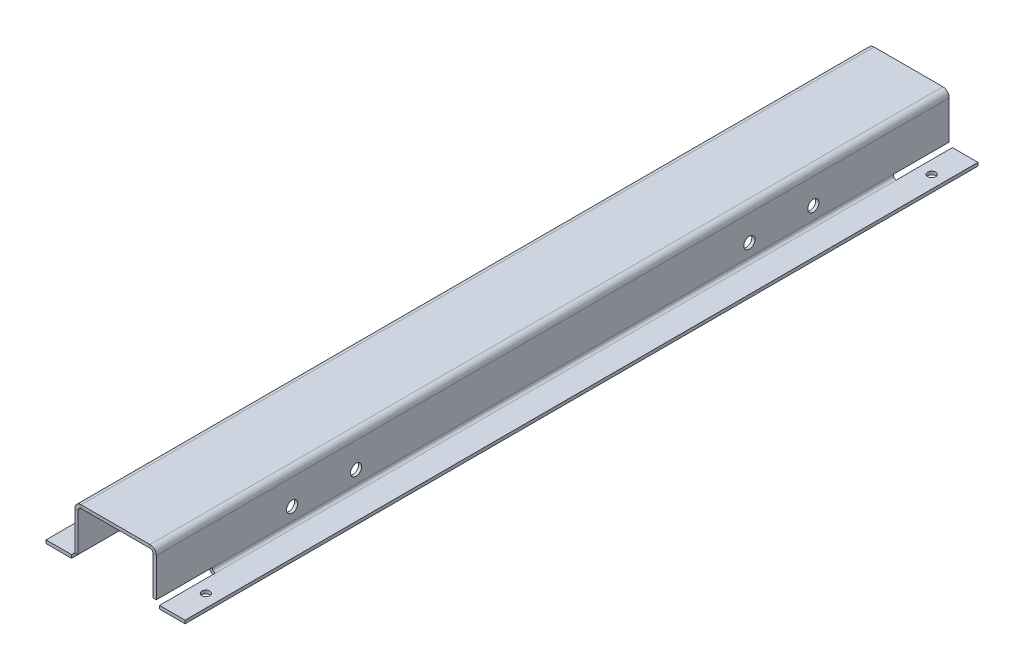
from build123d import *

# Parameters (mm, degrees)
SM_BASE_FLANGE_1_DEPTH   = 248
SKETCH_7_W               = 35
SKETCH_7_H               = 4
CUT_EXTRUDE_1_DEPTH      = 4
SKETCH_8_W               = 35
SKETCH_8_H               = 4
CUT_EXTRUDE_2_DEPTH      = 4
SKETCH_9_R               = 2.5
CUT_EXTRUDE_3_DEPTH      = 4
SKETCH_11_W              = 8.403654654
SKETCH_11_H              = 30.785672442
SKETCH_11_H_2            = 25.612573904
SM_BASE_FLANGE_1_2_DEPTH = 2
CUT_EXTRUDE_5_DEPTH      = 259.636810992
CUT_EXTRUDE_5_DEPTH_BACK = 259.636810992
SKETCH_14_R              = 3.5


# Sheet-metal steps are written as plain solids
with BuildPart() as part:
    # Sketch 1 → Sm Base Flange 1 (new, symmetric)
    with BuildSketch(Plane.XY):
        with BuildLine():
            Line((-43.5, -30), (-27.5, -30))
            ThreePointArc((-27.5, -30), (-24.671572875, -28.828427125), (-23.5, -26))
            Line((-23.5, -26), (-23.5, -2))
            ThreePointArc((-23.5, -2), (-22.914213562, -0.585786438), (-21.5, 0))
            Line((-21.5, 0), (21.5, 0))
            ThreePointArc((21.5, 0), (22.914213562, -0.585786438), (23.5, -2))
            Line((23.5, -2), (23.5, -26))
            ThreePointArc((23.5, -26), (24.671572875, -28.828427125), (27.5, -30))
            Line((27.5, -30), (43.5, -30))
            Line((43.5, -30), (43.5, -28))
            Line((43.5, -28), (27.5, -28))
            ThreePointArc((27.5, -28), (26.085786438, -27.414213562), (25.5, -26))
            Line((25.5, -26), (25.5, -2))
            ThreePointArc((25.5, -2), (24.328427125, 0.828427125), (21.5, 2))
            Line((21.5, 2), (-21.5, 2))
            ThreePointArc((-21.5, 2), (-24.328427125, 0.828427125), (-25.5, -2))
            Line((-25.5, -2), (-25.5, -26))
            ThreePointArc((-25.5, -26), (-26.085786438, -27.414213562), (-27.5, -28))
            Line((-27.5, -28), (-43.5, -28))
            Line((-43.5, -28), (-43.5, -30))
        make_face()
    extrude(amount=SM_BASE_FLANGE_1_DEPTH, both=True)

    # Эскиз7 → Вырез-Вытянуть1 (cut)
    with BuildSketch(Plane.ZY.offset(-23.5)):
        with Locations((230.5, -28)):
            Rectangle(SKETCH_7_W, SKETCH_7_H)
        with Locations((-230.5, -28)):
            Rectangle(SKETCH_7_W, SKETCH_7_H)
    extrude(amount=-CUT_EXTRUDE_1_DEPTH, mode=Mode.SUBTRACT)

    # Эскиз8 → Вырез-Вытянуть2 (cut)
    with BuildSketch(Plane(origin=(-23.5, 0, 0), x_dir=(0, 0, -1), z_dir=(1, 0, 0))):
        with Locations((230.5, -28)):
            Rectangle(SKETCH_8_W, SKETCH_8_H)
        with Locations((-230.5, -28)):
            Rectangle(SKETCH_8_W, SKETCH_8_H)
    extrude(amount=-CUT_EXTRUDE_2_DEPTH, mode=Mode.SUBTRACT)

    # Эскиз9 → Вырез-Вытянуть3 (cut)
    with BuildSketch(Plane(origin=(0, -28, 0), x_dir=(1, 0, 0), z_dir=(0, 1, 0))):
        with Locations(Location((-35.5, 227, 0), (0, 0, 180))):
            Circle(SKETCH_9_R)
        with Locations(Location((-34.5, 195, 0), (0, 0, 180))):
            Circle(SKETCH_9_R)
        with Locations(Location((-34.5, 179, 0), (0, 0, 180))):
            Circle(SKETCH_9_R)
        with Locations((-34.5, -179)):
            Circle(SKETCH_9_R)
        with Locations((-34.5, -195)):
            Circle(SKETCH_9_R)
        with Locations((-35.5, -227)):
            Circle(SKETCH_9_R)
        with Locations((35.5, 227)):
            Circle(SKETCH_9_R)
        with Locations(Location((35.5, -227, 0), (0, 0, 180))):
            Circle(SKETCH_9_R)
    extrude(amount=-CUT_EXTRUDE_3_DEPTH, mode=Mode.SUBTRACT)

    # Эскиз11 → Sm Base Flange 1 2 (add)
    with BuildSketch(Plane(origin=(0, -28, 0), x_dir=(1, 0, 0), z_dir=(0, 1, 0))):
        with Locations((-34.752058472, -185.409493447)):
            Rectangle(SKETCH_11_W, SKETCH_11_H)
        with Locations((-34.752058472, 186.746789547)):
            Rectangle(SKETCH_11_W, SKETCH_11_H_2)
    extrude(amount=-SM_BASE_FLANGE_1_2_DEPTH)

    # Эскиз14 → Вырез-Вытянуть5 (cut, two sides: drawn at the far end of the back side and taken through both)
    with BuildSketch(Plane(origin=(-23.5, 0, 0), x_dir=(0, 0, -1), z_dir=(1, 0, 0)).offset(-CUT_EXTRUDE_5_DEPTH_BACK)):
        with Locations(Location((-163, -18, 0), (0, 0, 90))):
            Circle(SKETCH_14_R)
        with Locations(Location((-123, -18, 0), (0, 0, 90))):
            Circle(SKETCH_14_R)
        with Locations(Location((123, -18, 0), (0, 0, 90))):
            Circle(SKETCH_14_R)
        with Locations(Location((163, -18, 0), (0, 0, 90))):
            Circle(SKETCH_14_R)
    extrude(amount=CUT_EXTRUDE_5_DEPTH + CUT_EXTRUDE_5_DEPTH_BACK, mode=Mode.SUBTRACT)


solid = part.part
